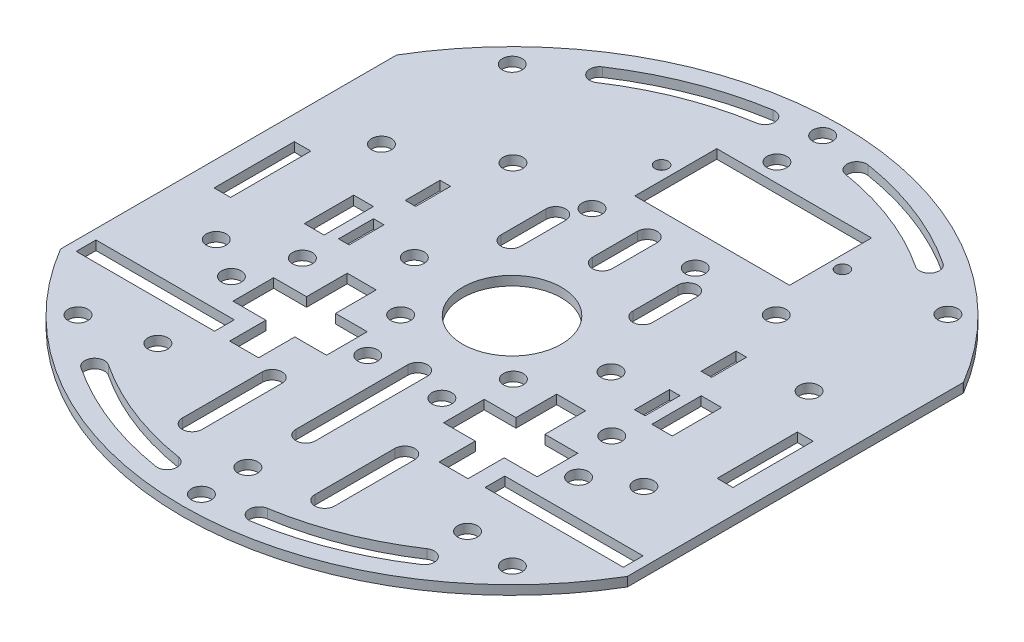
from build123d import *

# Parameters (mm, degrees)
ESQUISSE1_R             = 1.5
ESQUISSE1_W             = 1.6
ESQUISSE1_H             = 5.3
ESQUISSE1_W_2           = 2.5
ESQUISSE1_H_2           = 12.187925894
ESQUISSE1_W_3           = 3
ESQUISSE1_H_3           = 7.5
ESQUISSE1_R_2           = 1
ESQUISSE1_R_3           = 7.5
ESQUISSE1_W_4           = 3.09879963
ESQUISSE1_W_5           = 2.408451493
ESQUISSE1_W_6           = 23.501125708
ESQUISSE1_H_4           = 12.442637558
BOSS_EXTRU_1_DEPTH      = 1.4
ESQUISSE2_W             = 21
ESQUISSE2_H             = 3
ENL_V_MAT_EXTRU_1_DEPTH = 10


with BuildPart() as part:
    # Esquisse1 → Boss.-Extru.1 (new body)
    with BuildSketch(Plane(origin=(0, 0, 0), x_dir=(1, 0, 0), z_dir=(0, 1, 0))):
        with BuildLine():
            Line((35.834434648, 167.520022271), (35.834434648, 116.483137771))
            ThreePointArc((35.834434648, 116.483137771), (78.874434648, 91.965268258), (121.914434648, 116.483137771))
            Line((121.914434648, 116.483137771), (121.914434648, 116.551281317))
            Line((121.914434648, 116.551281317), (121.914434648, 167.451878725))
            ThreePointArc((121.914434648, 167.451878725), (121.905555919, 167.517672727), (121.879554918, 167.578759801))
            ThreePointArc((121.879554918, 167.578759801), (78.840278049, 192.037880126), (35.834434648, 167.520022271))
        make_face()
        with Locations((45.826639299, 109.150380711)):
            Circle(ESQUISSE1_R, mode=Mode.SUBTRACT)
        with Locations((55.638558291, 111.468388624)):
            Circle(ESQUISSE1_R, mode=Mode.SUBTRACT)
        with BuildLine():
            ThreePointArc((71.647029759, 95.137737644), (61.941305066, 97.781552096), (53.012507585, 102.414847058))
            ThreePointArc((53.012507585, 102.414847058), (52.590292227, 104.493725167), (54.669170336, 104.915940525))
            ThreePointArc((54.669170336, 104.915940525), (63.032596319, 100.576025821), (72.123754479, 98.099617713))
            ThreePointArc((72.123754479, 98.099617713), (73.366332154, 96.380315319), (71.647029759, 95.137737644))
        make_face(mode=Mode.SUBTRACT)
        with Locations((78.779387596, 94.934167737)):
            Circle(ESQUISSE1_R, mode=Mode.SUBTRACT)
        with Locations((78.779387596, 101.991662508)):
            Circle(ESQUISSE1_R, mode=Mode.SUBTRACT)
        with BuildLine():
            ThreePointArc((67.298661598, 115.661128867), (68.798661598, 117.161128867), (70.298661598, 115.661128867))
            Line((70.298661598, 115.661128867), (70.298661598, 103.507050761))
            ThreePointArc((70.298661598, 103.507050761), (68.798661598, 102.007050761), (67.298661598, 103.507050761))
            Line((67.298661598, 103.507050761), (67.298661598, 115.661128867))
        make_face(mode=Mode.SUBTRACT)
        with Locations((52.421601233, 125.843457604)):
            Circle(ESQUISSE1_R, mode=Mode.SUBTRACT)
        with Locations((46.409268342, 129.560473998)):
            Circle(ESQUISSE1_R, mode=Mode.SUBTRACT)
        with Locations((55.393988642, 133.652108861)):
            Circle(ESQUISSE1_R, mode=Mode.SUBTRACT)
        with Locations((56.403512098, 141.588703433)):
            Rectangle(ESQUISSE1_W, ESQUISSE1_H, mode=Mode.SUBTRACT)
        Polygon((55.777306889, 122.723571348), (55.777306889, 128.903170923), (60.777306889, 128.903170923), (60.777306889, 135.08096829), (65.174368531, 135.08096829), (65.174368531, 128.903170923), (69.992497573, 128.903170923), (69.992497573, 122.723571348), (65.174368531, 122.723571348), (65.174368531, 117.226495279), (60.777306889, 117.226495279), (60.777306889, 122.723571348), align=None, mode=Mode.SUBTRACT)
        with Locations((73.158157676, 125.813371136)):
            Circle(ESQUISSE1_R, mode=Mode.SUBTRACT)
        with Locations((70.317992081, 133.652108861)):
            Circle(ESQUISSE1_R, mode=Mode.SUBTRACT)
        with BuildLine():
            ThreePointArc((103.079698961, 104.915940525), (105.158577069, 104.493725167), (104.736361712, 102.414847058))
            ThreePointArc((104.736361712, 102.414847058), (95.80756423, 97.781552096), (86.101839537, 95.137737644))
            ThreePointArc((86.101839537, 95.137737644), (84.382537143, 96.380315319), (85.625114817, 98.099617713))
            ThreePointArc((85.625114817, 98.099617713), (94.716272977, 100.576025821), (103.079698961, 104.915940525))
        make_face(mode=Mode.SUBTRACT)
        with BuildLine():
            Line((87.432291643, 103.507050761), (87.432291643, 115.661128867))
            ThreePointArc((87.432291643, 115.661128867), (88.932291643, 117.161128867), (90.432291643, 115.661128867))
            Line((90.432291643, 115.661128867), (90.432291643, 103.507050761))
            ThreePointArc((90.432291643, 103.507050761), (88.932291643, 102.007050761), (87.432291643, 103.507050761))
        make_face(mode=Mode.SUBTRACT)
        with Locations((103.866070776, 110.258751266)):
            Circle(ESQUISSE1_R, mode=Mode.SUBTRACT)
        with Locations((111.829584697, 109.103509138)):
            Circle(ESQUISSE1_R, mode=Mode.SUBTRACT)
        with BuildLine():
            ThreePointArc((77.407537365, 127.639089221), (78.907537365, 129.139089221), (80.407537365, 127.639089221))
            Line((80.407537365, 127.639089221), (80.407537365, 110.639089221))
            ThreePointArc((80.407537365, 110.639089221), (78.907537365, 109.139089221), (77.407537365, 110.639089221))
            Line((77.407537365, 110.639089221), (77.407537365, 127.639089221))
        make_face(mode=Mode.SUBTRACT)
        with Locations((84.410371198, 125.813371136)):
            Circle(ESQUISSE1_R, mode=Mode.SUBTRACT)
        Polygon((92.574500765, 135.08096829), (96.971562407, 135.08096829), (96.971562407, 128.903170923), (101.971562407, 128.903170923), (101.971562407, 122.723571348), (96.971562407, 122.723571348), (96.971562407, 117.226495279), (92.574500765, 117.226495279), (92.574500765, 122.723571348), (87.756371724, 122.723571348), (87.756371724, 128.903170923), (92.574500765, 128.903170923), align=None, mode=Mode.SUBTRACT)
        with Locations((87.32715946, 133.757209253)):
            Circle(ESQUISSE1_R, mode=Mode.SUBTRACT)
        with Locations((105.167621672, 125.813371136)):
            Circle(ESQUISSE1_R, mode=Mode.SUBTRACT)
        with Locations((102.25609839, 133.757209253)):
            Circle(ESQUISSE1_R, mode=Mode.SUBTRACT)
        Polygon((102.145357199, 138.938703433), (100.545408567, 138.938687926), (100.545357199, 144.238687926), (102.145357199, 144.238703433), align=None, mode=Mode.SUBTRACT)
        with Locations((111.339600955, 129.560473998)):
            Circle(ESQUISSE1_R, mode=Mode.SUBTRACT)
        with Locations((40.707988868, 142.276611974)):
            Rectangle(ESQUISSE1_W_2, ESQUISSE1_H_2, mode=Mode.SUBTRACT)
        with Locations((52.502940431, 142.090510183)):
            Rectangle(ESQUISSE1_W_3, ESQUISSE1_H_3, mode=Mode.SUBTRACT)
        with Locations((56.403512098, 151.701300531)):
            Rectangle(ESQUISSE1_W, ESQUISSE1_H, mode=Mode.SUBTRACT)
        with Locations((46.409268342, 154.641573871)):
            Circle(ESQUISSE1_R, mode=Mode.SUBTRACT)
        with Locations((63.821984803, 142.221597832)):
            Circle(ESQUISSE1_R, mode=Mode.SUBTRACT)
        with Locations((58.859299527, 162.163285155)):
            Circle(ESQUISSE1_R, mode=Mode.SUBTRACT)
        with BuildLine():
            ThreePointArc((67.405550143, 158.615345539), (68.905550143, 160.115345539), (70.405550143, 158.615345539))
            Line((70.405550143, 158.615345539), (70.405550143, 151.80054615))
            ThreePointArc((70.405550143, 151.80054615), (68.905550143, 150.30054615), (67.405550143, 151.80054615))
            Line((67.405550143, 151.80054615), (67.405550143, 158.615345539))
        make_face(mode=Mode.SUBTRACT)
        with BuildLine():
            ThreePointArc((77.294154599, 162.614914575), (78.794154599, 164.114914575), (80.294154599, 162.614914575))
            Line((80.294154599, 162.614914575), (80.294154599, 155.800115186))
            ThreePointArc((80.294154599, 155.800115186), (78.794154599, 154.300115186), (77.294154599, 155.800115186))
            Line((77.294154599, 155.800115186), (77.294154599, 162.614914575))
        make_face(mode=Mode.SUBTRACT)
        with Locations((70.864412562, 162.163285155)):
            Circle(ESQUISSE1_R, mode=Mode.SUBTRACT)
        with Locations((45.826639299, 175.080590631)):
            Circle(ESQUISSE1_R, mode=Mode.SUBTRACT)
        with Locations((70.405550143, 173.185321498)):
            Circle(ESQUISSE1_R_2, mode=Mode.SUBTRACT)
        with BuildLine():
            ThreePointArc((54.669170336, 179.087219517), (52.590292227, 179.509434875), (53.012507585, 181.588312984))
            ThreePointArc((53.012507585, 181.588312984), (61.941305066, 186.221607946), (71.647029759, 188.865422397))
            ThreePointArc((71.647029759, 188.865422397), (73.366332154, 187.622844723), (72.123754479, 185.903542329))
            ThreePointArc((72.123754479, 185.903542329), (63.032596319, 183.427134221), (54.669170336, 179.087219517))
        make_face(mode=Mode.SUBTRACT)
        with Locations((78.779387596, 182.324270154)):
            Circle(ESQUISSE1_R, mode=Mode.SUBTRACT)
        with Locations((78.779387596, 189.265840996)):
            Circle(ESQUISSE1_R, mode=Mode.SUBTRACT)
        with Locations((78.874434648, 142.001580021)):
            Circle(ESQUISSE1_R_3, mode=Mode.SUBTRACT)
        with Locations((93.783075314, 142.123577455)):
            Circle(ESQUISSE1_R, mode=Mode.SUBTRACT)
        with BuildLine():
            Line((87.432291643, 151.80054615), (87.432291643, 158.615345539))
            ThreePointArc((87.432291643, 158.615345539), (88.932291643, 160.115345539), (90.432291643, 158.615345539))
            Line((90.432291643, 158.615345539), (90.432291643, 151.80054615))
            ThreePointArc((90.432291643, 151.80054615), (88.932291643, 150.30054615), (87.432291643, 151.80054615))
        make_face(mode=Mode.SUBTRACT)
        with Locations((86.533099498, 162.163285155)):
            Circle(ESQUISSE1_R, mode=Mode.SUBTRACT)
        with Locations((98.837943517, 162.163285155)):
            Circle(ESQUISSE1_R, mode=Mode.SUBTRACT)
        with Locations((105.316670961, 142.090510183)):
            Rectangle(ESQUISSE1_W_4, ESQUISSE1_H_3, mode=Mode.SUBTRACT)
        Polygon((102.145357199, 149.055077174), (100.545310556, 149.05129834), (100.545259188, 154.351313005), (102.145357199, 154.355091961), align=None, mode=Mode.SUBTRACT)
        with Locations((117.040821997, 142.276611974)):
            Rectangle(ESQUISSE1_W_5, ESQUISSE1_H_2, mode=Mode.SUBTRACT)
        with Locations((111.339600955, 154.641573871)):
            Circle(ESQUISSE1_R, mode=Mode.SUBTRACT)
        with Locations((84.201914375, 173.296740459)):
            Rectangle(ESQUISSE1_W_6, ESQUISSE1_H_4, mode=Mode.SUBTRACT)
        with Locations((97.864345109, 173.185321498)):
            Circle(ESQUISSE1_R_2, mode=Mode.SUBTRACT)
        with BuildLine():
            ThreePointArc((86.101839537, 188.865422397), (95.80756423, 186.221607946), (104.736361712, 181.588312984))
            ThreePointArc((104.736361712, 181.588312984), (105.158577069, 179.509434875), (103.079698961, 179.087219517))
            ThreePointArc((103.079698961, 179.087219517), (94.716272977, 183.427134221), (85.625114817, 185.903542329))
            ThreePointArc((85.625114817, 185.903542329), (84.382537143, 187.622844723), (86.101839537, 188.865422397))
        make_face(mode=Mode.SUBTRACT)
        with Locations((111.789066553, 175.276830964)):
            Circle(ESQUISSE1_R, mode=Mode.SUBTRACT)
    extrude(amount=BOSS_EXTRU_1_DEPTH)

    # Esquisse2 → Enlèv. mat.-Extru.1 (cut)
    with BuildSketch(Plane(origin=(0, 0, 0), x_dir=(-1, 0, 0), z_dir=(0, -1, 0))):
        with Locations((-109.914434648, 118.872546494)):
            Rectangle(ESQUISSE2_W, ESQUISSE2_H)
        with Locations((-47.834434648, 118.873137771)):
            Rectangle(ESQUISSE2_W, ESQUISSE2_H)
    extrude(amount=-ENL_V_MAT_EXTRU_1_DEPTH, mode=Mode.SUBTRACT)


solid = part.part
